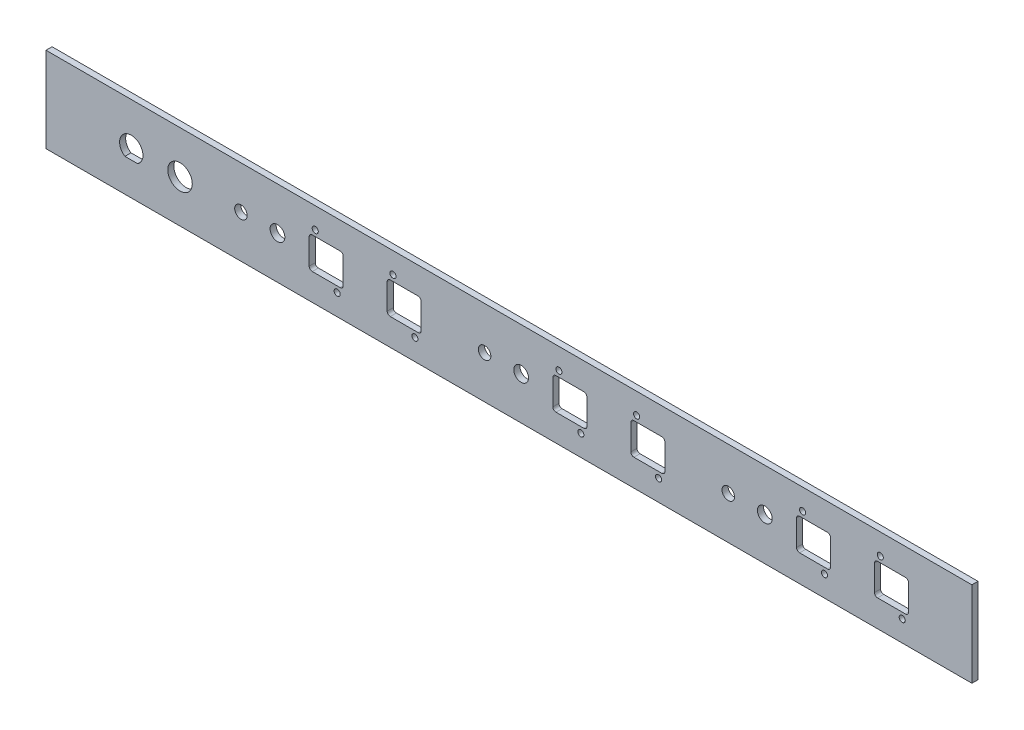
from build123d import *

# Parameters (mm, degrees)
SKETCH1_W              = 482.6
SKETCH1_H              = 44.45
BOSS_EXTRUDE1_DEPTH    = 3.175
SKETCH4_R              = 6.3881
CUT_EXTRUDE1_DEPTH     = 243.342157393
SKETCH3_R              = 3.85
SKETCH3_R_2            = 3.2512
SKETCH3_R_3            = 1.5875
SKETCH3_W              = 17.7292
SKETCH3_H              = 16.51
CUT_EXTRUDE2_DEPTH     = 243.342157393
FILLET1_R              = 1.6002
LPATTERN1_COUNT        = 3
LPATTERN1_PITCH        = 127
FILLET1_OF_LPATTERN1_R = 1.6002


with BuildPart() as part:
    # Sketch1 → Boss-Extrude1 (new body)
    with BuildSketch(Plane.XY):
        Rectangle(SKETCH1_W, SKETCH1_H)
    extrude(amount=BOSS_EXTRUDE1_DEPTH)

    # Sketch4 → Cut-Extrude1 (cut, through all)
    with BuildSketch(Plane.XY.offset(3.175)):
        with Locations((-171.45, 0)):
            Circle(SKETCH4_R)
        with BuildLine():
            Line((-200.181081932, -5.1054), (-193.518918068, -5.1054))
            ThreePointArc((-193.518918068, -5.1054), (-196.85, 6.096), (-200.181081932, -5.1054))
        make_face()
    extrude(amount=-CUT_EXTRUDE1_DEPTH, mode=Mode.SUBTRACT)

    # Sketch3 → Cut-Extrude2 (cut, through all)
    with BuildSketch(Plane.XY.offset(3.175)):
        with Locations((-120.65, 0)):
            Circle(SKETCH3_R)
        with Locations((-139.7, 0)):
            Circle(SKETCH3_R_2)
        with Locations((-100.965, 11.303)):
            Circle(SKETCH3_R_3)
        with Locations((-89.535, -11.303)):
            Circle(SKETCH3_R_3)
        with Locations((-60.452, 11.303)):
            Circle(SKETCH3_R_3)
        with Locations((-49.022, -11.303)):
            Circle(SKETCH3_R_3)
        with Locations((-95.25, 0)):
            Rectangle(SKETCH3_W, SKETCH3_H)
        with Locations((-54.61, 0)):
            Rectangle(SKETCH3_W, SKETCH3_H)
    cut_extrude2 = extrude(amount=-CUT_EXTRUDE2_DEPTH, mode=Mode.SUBTRACT)

    # Fillet1
    fillet1_edges = [part.edges().sort_by_distance(p)[0] for p in [
        (-63.4746, 8.255, 1.5875),
        (-63.4746, -8.255, 1.5875),
        (-86.3854, -8.255, 1.5875),
        (-45.7454, -8.255, 1.5875),
        (-45.7454, 8.255, 1.5875),
        (-86.3854, 8.255, 1.5875),
        (-104.1146, 8.255, 1.5875),
        (-104.1146, -8.255, 1.5875),
    ]]
    fillet(fillet1_edges, radius=FILLET1_R)

    # LPattern1: Cut-Extrude2 ×3
    with Locations(*[(i * LPATTERN1_PITCH, 0, 0) for i in range(1, LPATTERN1_COUNT)]):
        add(cut_extrude2, mode=Mode.SUBTRACT)

    # Fillet1 of LPattern1
    fillet1_of_lpattern1_edges = [part.edges().sort_by_distance(p)[0] for p in [
        (63.5254, 8.255, 1.5875),
        (63.5254, -8.255, 1.5875),
        (40.6146, -8.255, 1.5875),
        (81.2546, -8.255, 1.5875),
        (81.2546, 8.255, 1.5875),
        (40.6146, 8.255, 1.5875),
        (22.8854, 8.255, 1.5875),
        (22.8854, -8.255, 1.5875),
        (190.5254, 8.255, 1.5875),
        (190.5254, -8.255, 1.5875),
        (167.6146, -8.255, 1.5875),
        (208.2546, -8.255, 1.5875),
        (208.2546, 8.255, 1.5875),
        (167.6146, 8.255, 1.5875),
        (149.8854, 8.255, 1.5875),
        (149.8854, -8.255, 1.5875),
    ]]
    fillet(fillet1_of_lpattern1_edges, radius=FILLET1_OF_LPATTERN1_R)


solid = part.part
